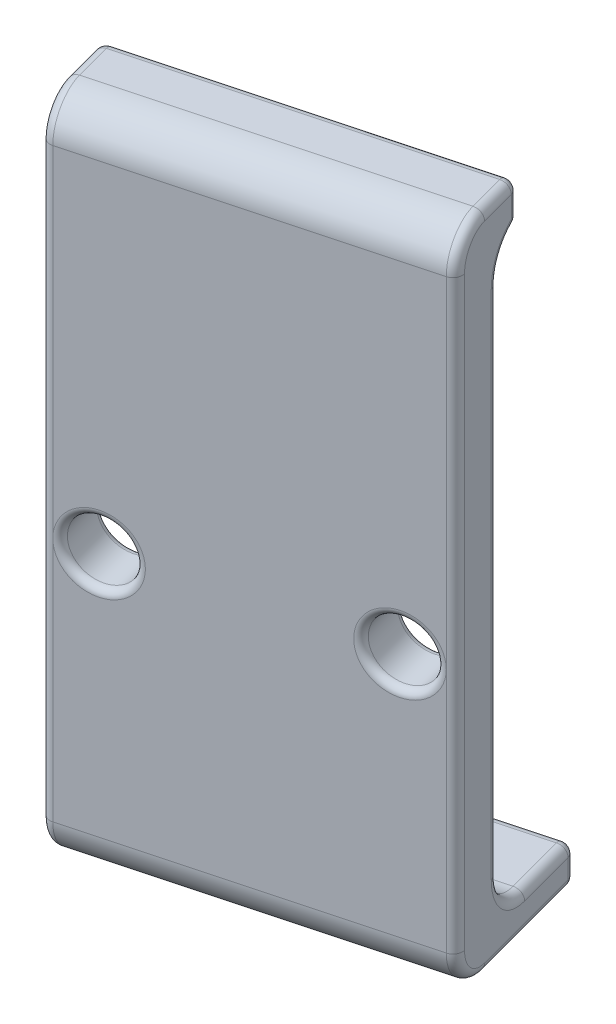
from build123d import *

# Parameters (mm, degrees)
SKETCH1_R           = 1.6
BOSS_EXTRUDE1_DEPTH = 3
SKETCH1_3_W         = 18
SKETCH1_3_H         = 2
BOSS_EXTRUDE2_DEPTH = 5.75
SKETCH1_4_W         = 18
SKETCH1_4_H         = 2
BOSS_EXTRUDE3_DEPTH = 1.5
FILLET1_R           = 2
FILLET2_R           = 0.5
FILLET3_R           = 0.4


# Some blends are built 0.0001 mm under size
with BuildPart() as part:
    # Sketch1 → Boss-Extrude1 (new body)
    with BuildSketch(Plane(origin=(-4.458657666, 0, -16.639936943), x_dir=(0.9659258262890681, 0, -0.25881904510252135), z_dir=(0.25881904510252135, 0, 0.9659258262890681))):
        Polygon((-63.6, -11.75), (-63.6, 8.25), (-45.6, 8.25), (-45.6, -11.75), (-45.6, -26.75), (-63.6, -26.75), align=None)
        with Locations((-61.1, -11.75)):
            Circle(SKETCH1_R, mode=Mode.SUBTRACT)
        with Locations((-48.1, -11.75)):
            Circle(SKETCH1_R, mode=Mode.SUBTRACT)
    extrude(amount=BOSS_EXTRUDE1_DEPTH)

    # Sketch1<3> → Boss-Extrude2 (add)
    with BuildSketch(Plane(origin=(-4.458657666, 0, -16.639936943), x_dir=(0.9659258262890681, 0, -0.25881904510252135), z_dir=(0.25881904510252135, 0, 0.9659258262890681))):
        with Locations((-54.6, -25.75)):
            Rectangle(SKETCH1_3_W, SKETCH1_3_H)
    extrude(amount=-BOSS_EXTRUDE2_DEPTH)

    # Sketch1<4> → Boss-Extrude3 (add)
    with BuildSketch(Plane(origin=(-4.458657666, 0, -16.639936943), x_dir=(0.9659258262890681, 0, -0.25881904510252135), z_dir=(0.25881904510252135, 0, 0.9659258262890681))):
        with Locations((-54.6, 7.25)):
            Rectangle(SKETCH1_4_W, SKETCH1_4_H)
    extrude(amount=-BOSS_EXTRUDE3_DEPTH)

    # Fillet1
    # the kernel refuses this fillet: 2 mm, written as the material it adds along each edge
    with BuildSketch(Plane(origin=(-65.891540218, 6.25, -0.179045674), x_dir=(0, -1, 0), z_dir=(0.9659258262890681, 0, -0.25881904510252135))) as fillet1_piece_1:
        with BuildLine():
            CenterArc((1.936491673, 2), FILLET1_R, 194.477512186, 75.522487814)
            Line((0, 1.5), (0, 0))
            Line((0, 0), (1.936491673, 0))
        make_face()
    extrude(amount=18)
    with BuildSketch(Plane(origin=(-48.504875345, -24.75, -4.837788486), x_dir=(-0.2588190451025214, 0, -0.9659258262890682), z_dir=(-0.9659258262890681, 0, 0.25881904510252135))) as fillet1_piece_2:
        with BuildLine():
            CenterArc((FILLET1_R, -FILLET1_R), FILLET1_R, 90, 90)
            Line((0, -FILLET1_R), (0, 0))
            Line((0, 0), (FILLET1_R, 0))
        make_face()
    extrude(amount=18)
    # the kernel refuses this fillet: 2 mm, written as the material it takes off along each edge
    with BuildSketch(Plane(origin=(-69.944712214, 8.25, 4.01282703), x_dir=(-0.2588190451025214, 0, -0.9659258262890682), z_dir=(0.9659258262890681, 0, -0.25881904510252135)), Plane(origin=(-42.898789078, -26.75, -3.234106233), x_dir=(-0.2588190451025214, 0, -0.9659258262890682), z_dir=(-0.9659258262890681, 0, 0.25881904510252135))) as fillet1_2_piece_1:
        with BuildLine():
            CenterArc((FILLET1_R, -FILLET1_R), FILLET1_R, 90, 90)
            Line((0, -FILLET1_R), (0, 0))
            Line((0, 0), (FILLET1_R, 0))
        make_face()
    extrude(amount=28, mode=Mode.SUBTRACT)

    # Fillet2
    fillet2_edges = [part.edges().sort_by_distance(p)[0] for p in [
        (-67.379749727, -25.75, -5.733119175),
        (-58.686417291, -26.75, -8.062490581),
        (-49.507799144, -24.75, -8.580751063),
        (-66.894464018, -24.75, -3.922008251),
        (-58.686417291, -24.75, -8.062490581),
        (-49.993084854, -25.75, -10.391861987),
        (-57.586436349, 8.25, -3.95730582),
        (-48.893103912, 7.25, -6.286677225),
        (-57.586436349, 6.25, -3.95730582),
        (-66.279768786, 7.25, -1.627934414),
        (-65.891540218, -9.218245837, -0.179045674),
        (-48.504875345, -9.218245837, -4.837788486),
        (-47.728418209, -9.25, -1.940011007),
        (-65.115083083, -9.25, 2.718731805),
        (-65.956244979, 8.25, -0.420527131),
        (-66.50623545, -26.75, -2.473119512),
        (-65.266695769, -26.164213562, 2.152905556),
        (-65.266695769, 7.664213562, 2.152905556),
        (-48.569580106, 8.25, -5.079269943),
        (-49.119570577, -26.75, -7.131862323),
        (-47.880030896, -26.164213562, -2.505837256),
        (-47.880030896, 7.664213562, -2.505837256),
        (-48.613284593, 5.538253198, -5.242377308),
        (-65.999949466, 5.538253198, -0.583634496),
        (-48.656488031, -24.164213562, -5.403614735),
        (-66.043152904, -24.164213562, -0.744871923),
    ]]
    fillet(fillet2_edges, radius=FILLET2_R)

    # Fillet3
    fillet3_edges = [part.edges().sort_by_distance(p)[0] for p in [
        (-64.245749839, -11.75, 2.485794664),
        (-65.022206974, -11.75, -0.411982815),
        (-51.688714097, -11.75, -0.878852922),
        (-52.465171232, -11.75, -3.776630401),
    ]]
    fillet(fillet3_edges, radius=FILLET3_R - 0.0001)  # a hair under: the kernel refuses the full size


solid = part.part
